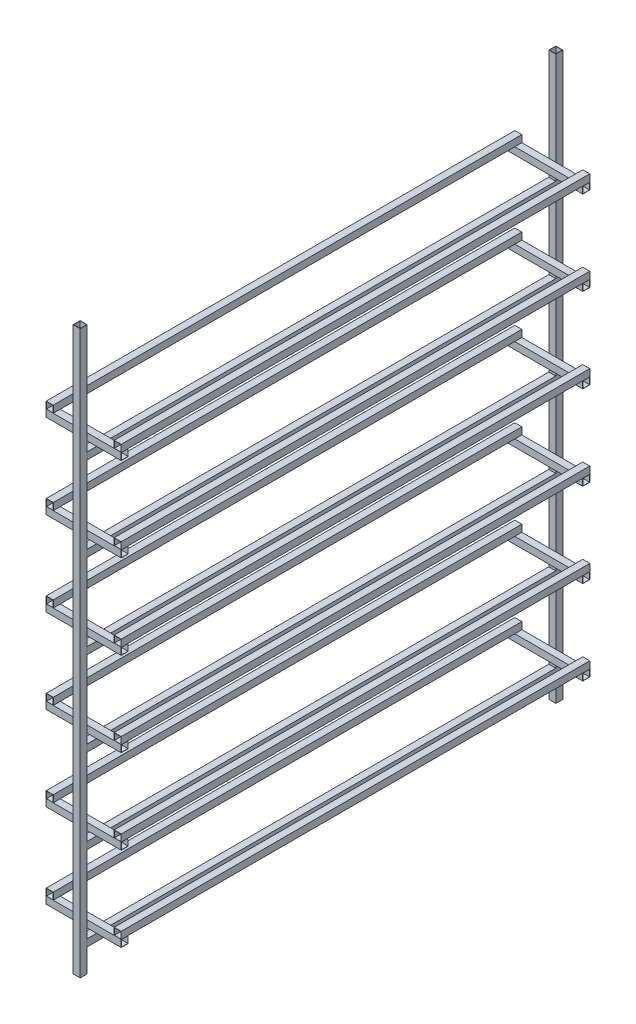
from build123d import *

# Parameters (mm, degrees)
CROQUIS1_W                    = 30
CROQUIS1_H                    = 30
CROQUIS1_W_2                  = 28
CROQUIS1_H_2                  = 28
EXTRUIR_L_MINA1_DEPTH         = 2400
CROQUIS2_W                    = 30
CROQUIS2_H                    = 30
CROQUIS2_W_2                  = 28
CROQUIS2_H_2                  = 28
EXTRUIR_L_MINA2_DEPTH         = 2000
MATRIZL6_COUNT                = 6
MATRIZL6_PITCH                = 360
CROQUIS3_W                    = 30
CROQUIS3_H                    = 30
CROQUIS3_W_2                  = 28
CROQUIS3_H_2                  = 28
EXTRUIR_L_MINA3_DEPTH         = 2400
EXTRUIR_L_MINA4_START         = -160
EXTRUIR_L_MINA4_OUTLINE_W     = 30
EXTRUIR_L_MINA4_OUTLINE_H     = 30
EXTRUIR_L_MINA4_OUTLINE_W_2   = 28
EXTRUIR_L_MINA4_OUTLINE_H_2   = 28
EXTRUIR_L_MINA4_DEPTH         = 320
EXTRUIR_L_MINA4_2_OUTLINE_W   = 30
EXTRUIR_L_MINA4_2_OUTLINE_H   = 30
EXTRUIR_L_MINA4_2_OUTLINE_W_2 = 28
EXTRUIR_L_MINA4_2_OUTLINE_H_2 = 28
EXTRUIR_L_MINA4_2_DEPTH       = 320
MATRIZL7_COUNT                = 6
MATRIZL7_PITCH                = 360
MATRIZL8_COUNT                = 6
MATRIZL8_PITCH                = 360
EXTRUIR_L_MINA5_START         = -2000
EXTRUIR_L_MINA5_OUTLINE_W     = 30
EXTRUIR_L_MINA5_OUTLINE_H     = 30
EXTRUIR_L_MINA5_OUTLINE_W_2   = 28
EXTRUIR_L_MINA5_OUTLINE_H_2   = 28
EXTRUIR_L_MINA5_DEPTH         = 2000
EXTRUIR_L_MINA5_2_OUTLINE_W   = 30
EXTRUIR_L_MINA5_2_OUTLINE_H   = 30
EXTRUIR_L_MINA5_2_OUTLINE_W_2 = 28
EXTRUIR_L_MINA5_2_OUTLINE_H_2 = 28
EXTRUIR_L_MINA5_2_DEPTH       = 2000
MATRIZL9_COUNT                = 6
MATRIZL9_PITCH                = 360


with BuildPart() as part:
    # Croquis1 → Extruir-Lámina1 (new body)
    with BuildSketch(Plane(origin=(0, 0, 0), x_dir=(1, 0, 0), z_dir=(0, 1, 0))):
        Rectangle(CROQUIS1_W, CROQUIS1_H)
        Rectangle(CROQUIS1_W_2, CROQUIS1_H_2, mode=Mode.SUBTRACT)
    extrude(amount=EXTRUIR_L_MINA1_DEPTH)


with BuildPart() as body_2:
    # Croquis2 → Extruir-Lámina2 (new body)
    with BuildSketch(Plane(origin=(0, 0, -15), x_dir=(-1, 0, 0), z_dir=(0, 0, -1))):
        with Locations((0, 115)):
            Rectangle(CROQUIS2_W, CROQUIS2_H)
        with Locations((0, 115)):
            Rectangle(CROQUIS2_W_2, CROQUIS2_H_2, mode=Mode.SUBTRACT)
    extrude(amount=EXTRUIR_L_MINA2_DEPTH)


with BuildPart() as matrizl6_1:
    # MatrizL6: pattern copy
    add(body_2.part.moved(Location(Vector(0, 1, 0) * (1 * MATRIZL6_PITCH))))


with BuildPart() as matrizl6_2:
    # MatrizL6: pattern copy
    add(body_2.part.moved(Location(Vector(0, 1, 0) * (2 * MATRIZL6_PITCH))))


with BuildPart() as matrizl6_3:
    # MatrizL6: pattern copy
    add(body_2.part.moved(Location(Vector(0, 1, 0) * (3 * MATRIZL6_PITCH))))


with BuildPart() as matrizl6_4:
    # MatrizL6: pattern copy
    add(body_2.part.moved(Location(Vector(0, 1, 0) * (4 * MATRIZL6_PITCH))))


with BuildPart() as matrizl6_5:
    # MatrizL6: pattern copy
    add(body_2.part.moved(Location(Vector(0, 1, 0) * (5 * MATRIZL6_PITCH))))


with BuildPart() as body_2_1:
    add(body_2.part)

    add(matrizl6_1.part)  # Extruir-Lámina3 merges MatrizL6_1

    add(matrizl6_2.part)  # Extruir-Lámina3 merges MatrizL6_2

    add(matrizl6_3.part)  # Extruir-Lámina3 merges MatrizL6_3

    add(matrizl6_4.part)  # Extruir-Lámina3 merges MatrizL6_4

    add(matrizl6_5.part)  # Extruir-Lámina3 merges MatrizL6_5
    # Croquis3 → Extruir-Lámina3 (add)
    with BuildSketch(Plane(origin=(0, 0, 0), x_dir=(1, 0, 0), z_dir=(0, 1, 0))):
        with Locations((0, 2030)):
            Rectangle(CROQUIS3_W, CROQUIS3_H)
        with Locations((0, 2030)):
            Rectangle(CROQUIS3_W_2, CROQUIS3_H_2, mode=Mode.SUBTRACT)
    extrude(amount=EXTRUIR_L_MINA3_DEPTH)


with BuildPart() as body_3:
    # Extruir-Lámina4: read off the stored shape, not the designer's step
    # Extruir-Lámina4 outline → Extruir-Lámina4 (new body)
    with BuildSketch(Plane(origin=(0, 0, 0), x_dir=(0, 0, -1), z_dir=(1, 0, 0)).offset(EXTRUIR_L_MINA4_START)):
        with Locations((2000, 185)):
            Rectangle(EXTRUIR_L_MINA4_OUTLINE_W, EXTRUIR_L_MINA4_OUTLINE_H)
        with Locations((2000, 185)):
            Rectangle(EXTRUIR_L_MINA4_OUTLINE_W_2, EXTRUIR_L_MINA4_OUTLINE_H_2, mode=Mode.SUBTRACT)
    extrude(amount=EXTRUIR_L_MINA4_DEPTH)


with BuildPart() as body_4:
    # Extruir-L_mina4 2 outline → Extruir-L_mina4 2 (new body)
    with BuildSketch(Plane(origin=(0, 0, 0), x_dir=(0, 0, -1), z_dir=(1, 0, 0)).offset(EXTRUIR_L_MINA4_START)):
        with Locations((30, 185)):
            Rectangle(EXTRUIR_L_MINA4_2_OUTLINE_W, EXTRUIR_L_MINA4_2_OUTLINE_H)
        with Locations((30, 185)):
            Rectangle(EXTRUIR_L_MINA4_2_OUTLINE_W_2, EXTRUIR_L_MINA4_2_OUTLINE_H_2, mode=Mode.SUBTRACT)
    extrude(amount=EXTRUIR_L_MINA4_2_DEPTH)


with BuildPart() as matrizl7_1:
    # MatrizL7: pattern copy
    add(body_4.part.moved(Location(Vector(0, 1, 0) * (1 * MATRIZL7_PITCH))))


with BuildPart() as matrizl7_2:
    # MatrizL7: pattern copy
    add(body_4.part.moved(Location(Vector(0, 1, 0) * (2 * MATRIZL7_PITCH))))


with BuildPart() as matrizl7_3:
    # MatrizL7: pattern copy
    add(body_4.part.moved(Location(Vector(0, 1, 0) * (3 * MATRIZL7_PITCH))))


with BuildPart() as matrizl7_4:
    # MatrizL7: pattern copy
    add(body_4.part.moved(Location(Vector(0, 1, 0) * (4 * MATRIZL7_PITCH))))


with BuildPart() as matrizl7_5:
    # MatrizL7: pattern copy
    add(body_4.part.moved(Location(Vector(0, 1, 0) * (5 * MATRIZL7_PITCH))))


with BuildPart() as matrizl8_1:
    # MatrizL8: pattern copy
    add(body_3.part.moved(Location(Vector(0, 1, 0) * (1 * MATRIZL8_PITCH))))


with BuildPart() as matrizl8_2:
    # MatrizL8: pattern copy
    add(body_3.part.moved(Location(Vector(0, 1, 0) * (2 * MATRIZL8_PITCH))))


with BuildPart() as matrizl8_3:
    # MatrizL8: pattern copy
    add(body_3.part.moved(Location(Vector(0, 1, 0) * (3 * MATRIZL8_PITCH))))


with BuildPart() as matrizl8_4:
    # MatrizL8: pattern copy
    add(body_3.part.moved(Location(Vector(0, 1, 0) * (4 * MATRIZL8_PITCH))))


with BuildPart() as matrizl8_5:
    # MatrizL8: pattern copy
    add(body_3.part.moved(Location(Vector(0, 1, 0) * (5 * MATRIZL8_PITCH))))


with BuildPart() as body_15:
    # Extruir-Lámina5: read off the stored shape, not the designer's step
    # Extruir-Lámina5 outline → Extruir-Lámina5 (new body)
    with BuildSketch(Plane.XY.offset(-15).offset(EXTRUIR_L_MINA5_START)):
        with Locations((-145, 215)):
            Rectangle(EXTRUIR_L_MINA5_OUTLINE_W, EXTRUIR_L_MINA5_OUTLINE_H)
        with Locations((-145, 215)):
            Rectangle(EXTRUIR_L_MINA5_OUTLINE_W_2, EXTRUIR_L_MINA5_OUTLINE_H_2, mode=Mode.SUBTRACT)
    extrude(amount=EXTRUIR_L_MINA5_DEPTH)


with BuildPart() as body_16:
    # Extruir-L_mina5 2 outline → Extruir-L_mina5 2 (new body)
    with BuildSketch(Plane.XY.offset(-15).offset(EXTRUIR_L_MINA5_START)):
        with Locations((145, 215)):
            Rectangle(EXTRUIR_L_MINA5_2_OUTLINE_W, EXTRUIR_L_MINA5_2_OUTLINE_H)
        with Locations((145, 215)):
            Rectangle(EXTRUIR_L_MINA5_2_OUTLINE_W_2, EXTRUIR_L_MINA5_2_OUTLINE_H_2, mode=Mode.SUBTRACT)
    extrude(amount=EXTRUIR_L_MINA5_2_DEPTH)


with BuildPart() as matrizl9_1:
    # MatrizL9: pattern copy
    add(body_15.part.moved(Location(Vector(0, 1, 0) * (1 * MATRIZL9_PITCH))))


with BuildPart() as matrizl9_2:
    # MatrizL9: pattern copy
    add(body_15.part.moved(Location(Vector(0, 1, 0) * (2 * MATRIZL9_PITCH))))


with BuildPart() as matrizl9_3:
    # MatrizL9: pattern copy
    add(body_15.part.moved(Location(Vector(0, 1, 0) * (3 * MATRIZL9_PITCH))))


with BuildPart() as matrizl9_4:
    # MatrizL9: pattern copy
    add(body_15.part.moved(Location(Vector(0, 1, 0) * (4 * MATRIZL9_PITCH))))


with BuildPart() as matrizl9_5:
    # MatrizL9: pattern copy
    add(body_15.part.moved(Location(Vector(0, 1, 0) * (5 * MATRIZL9_PITCH))))


with BuildPart() as matrizl9_6:
    # MatrizL9: pattern copy
    add(body_16.part.moved(Location(Vector(0, 1, 0) * (1 * MATRIZL9_PITCH))))


with BuildPart() as matrizl9_7:
    # MatrizL9: pattern copy
    add(body_16.part.moved(Location(Vector(0, 1, 0) * (2 * MATRIZL9_PITCH))))


with BuildPart() as matrizl9_8:
    # MatrizL9: pattern copy
    add(body_16.part.moved(Location(Vector(0, 1, 0) * (3 * MATRIZL9_PITCH))))


with BuildPart() as matrizl9_9:
    # MatrizL9: pattern copy
    add(body_16.part.moved(Location(Vector(0, 1, 0) * (4 * MATRIZL9_PITCH))))


with BuildPart() as matrizl9_10:
    # MatrizL9: pattern copy
    add(body_16.part.moved(Location(Vector(0, 1, 0) * (5 * MATRIZL9_PITCH))))


solid = Compound([part.part, body_2_1.part, body_3.part, body_4.part, matrizl7_1.part, matrizl7_2.part, matrizl7_3.part, matrizl7_4.part, matrizl7_5.part, matrizl8_1.part, matrizl8_2.part, matrizl8_3.part, matrizl8_4.part, matrizl8_5.part, body_15.part, body_16.part, matrizl9_1.part, matrizl9_2.part, matrizl9_3.part, matrizl9_4.part, matrizl9_5.part, matrizl9_6.part, matrizl9_7.part, matrizl9_8.part, matrizl9_9.part, matrizl9_10.part])
